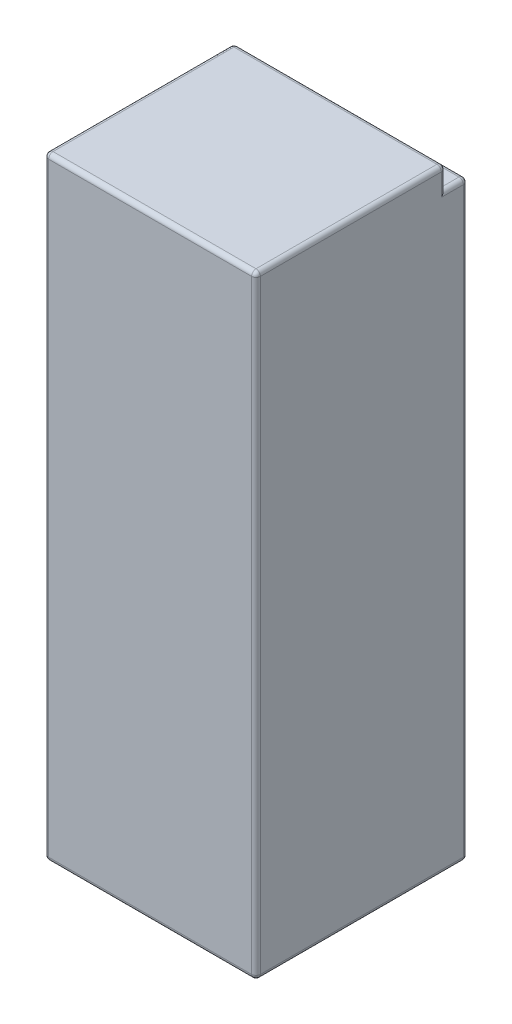
from build123d import *

# Parameters (mm, degrees)
SKETCH1_W               = 48
SKETCH1_H               = 48
BOSS_EXTRUDE1_DEPTH     = 69.5
CUT_EXTRUDE1_DEPTH      = 78.345006303
CUT_EXTRUDE1_DEPTH_BACK = 78.345006303
SKETCH2_W               = 5
SKETCH2_H               = 5
FILLET1_R               = 1


with BuildPart() as part:
    # Sketch1 → Boss-Extrude1 (new, symmetric)
    with BuildSketch(Plane(origin=(0, 0, 0), x_dir=(1, 0, 0), z_dir=(0, 1, 0))):
        Rectangle(SKETCH1_W, SKETCH1_H)
    extrude(amount=BOSS_EXTRUDE1_DEPTH, both=True)

    # Sketch2 → Cut-Extrude1 (cut, two sides: drawn at the far end of the back side and taken through both)
    with BuildSketch(Plane(origin=(0, 0, 0), x_dir=(0, 0, -1), z_dir=(1, 0, 0)).offset(-CUT_EXTRUDE1_DEPTH_BACK)):
        with Locations((21.5, 67)):
            Rectangle(SKETCH2_W, SKETCH2_H)
    extrude(amount=CUT_EXTRUDE1_DEPTH + CUT_EXTRUDE1_DEPTH_BACK, mode=Mode.SUBTRACT)

    # Fillet1
    fillet1_edges = [part.edges().sort_by_distance(p)[0] for p in [
        (24, 67, -19),
        (24, 64.5, -21.5),
        (-24, 67, -19),
        (-24, 64.5, -21.5),
        (0, 69.5, -19),
        (0, 64.5, -24),
        (-24, -69.5, 0),
        (0, -69.5, 24),
        (24, -69.5, 0),
        (0, -69.5, -24),
        (-24, 69.5, 2.5),
        (0, 69.5, 24),
        (24, 69.5, 2.5),
        (-24, -2.5, -24),
        (24, 0, 24),
        (-24, 0, 24),
        (24, -2.5, -24),
    ]]
    fillet(fillet1_edges, radius=FILLET1_R)


solid = part.part
